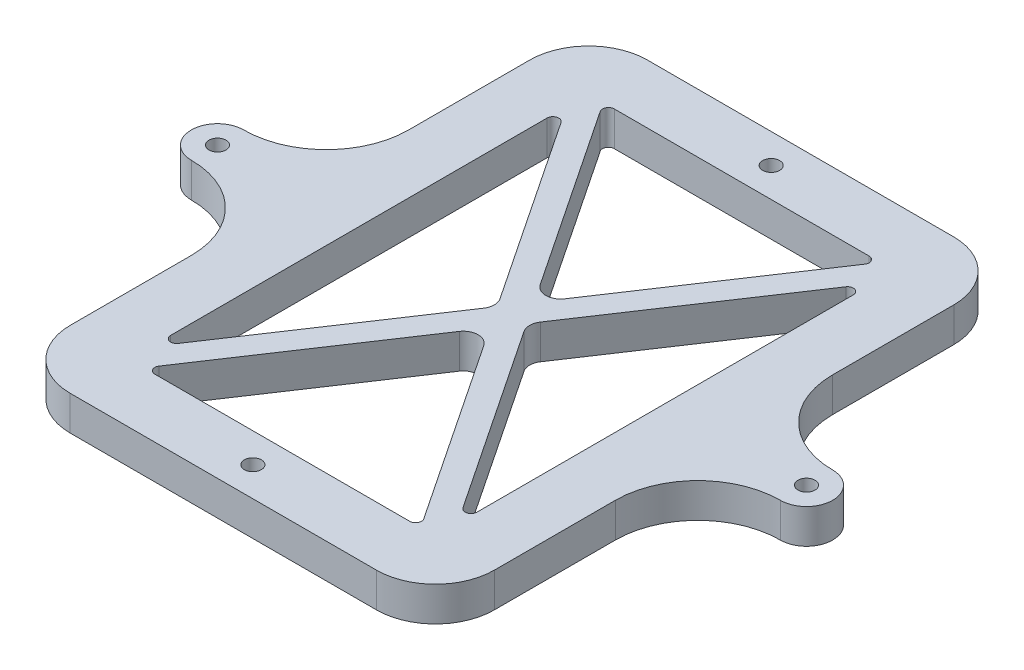
from build123d import *

# Parameters (mm, degrees)
SKETCH1_R           = 1.45
BOSS_EXTRUDE1_DEPTH = 5.85
FILLET1_R           = 1
FILLET2_R           = 2.5


with BuildPart() as part:
    # Sketch1 → Boss-Extrude1 (new body)
    with BuildSketch(Plane(origin=(0, 0, 0), x_dir=(1, 0, 0), z_dir=(0, 1, 0))):
        with BuildLine():
            ThreePointArc((-26, 49), (-33.071067812, 46.071067812), (-36, 39))
            Line((-36, 39), (-36, 18.45))
            ThreePointArc((-36, 18.45), (-40.100505063, 8.550505063), (-50, 4.45))
            ThreePointArc((-50, 4.45), (-54.45, 0), (-50, -4.45))
            ThreePointArc((-50, -4.45), (-40.100505063, -8.550505063), (-36, -18.45))
            Line((-36, -18.45), (-36, -39))
            ThreePointArc((-36, -39), (-33.071067812, -46.071067812), (-26, -49))
            Line((-26, -49), (26, -49))
            ThreePointArc((26, -49), (33.071067812, -46.071067812), (36, -39))
            Line((36, -39), (36, -18.45))
            ThreePointArc((36, -18.45), (40.100505063, -8.550505063), (50, -4.45))
            ThreePointArc((50, -4.45), (54.45, 0), (50, 4.45))
            ThreePointArc((50, 4.45), (40.100505063, 8.550505063), (36, 18.45))
            Line((36, 18.45), (36, 39))
            ThreePointArc((36, 39), (33.071067812, 46.071067812), (26, 49))
            Line((26, 49), (-26, 49))
        make_face()
        with Locations((-50, 0)):
            Circle(SKETCH1_R, mode=Mode.SUBTRACT)
        with Locations((50, 0)):
            Circle(SKETCH1_R, mode=Mode.SUBTRACT)
        Polygon((23.5, -39), (-23.5, -39), (0, -3.75), align=None, mode=Mode.SUBTRACT)
        Polygon((26, 35.25), (26, -35.25), (2.5, 0), align=None, mode=Mode.SUBTRACT)
        Polygon((-23.5, 39), (23.5, 39), (0, 3.75), align=None, mode=Mode.SUBTRACT)
        Polygon((-26, -35.25), (-26, 35.25), (-2.5, 0), align=None, mode=Mode.SUBTRACT)
        with Locations((0, 44)):
            Circle(SKETCH1_R, mode=Mode.SUBTRACT)
        with Locations((0, -44)):
            Circle(SKETCH1_R, mode=Mode.SUBTRACT)
    extrude(amount=BOSS_EXTRUDE1_DEPTH)

    # Fillet1
    fillet1_edges = [part.edges().sort_by_distance(p)[0] for p in [
        (-26, 2.925, 35.25),
        (-23.5, 2.925, 39),
        (23.5, 2.925, 39),
        (26, 2.925, 35.25),
        (26, 2.925, -35.25),
        (23.5, 2.925, -39),
        (-26, 2.925, -35.25),
        (-23.5, 2.925, -39),
    ]]
    fillet(fillet1_edges, radius=FILLET1_R)

    # Fillet2
    fillet2_edges = [part.edges().sort_by_distance(p)[0] for p in [
        (2.5, 2.925, 0),
        (0, 2.925, 3.75),
        (0, 2.925, -3.75),
        (-2.5, 2.925, 0),
    ]]
    fillet(fillet2_edges, radius=FILLET2_R)


solid = part.part
